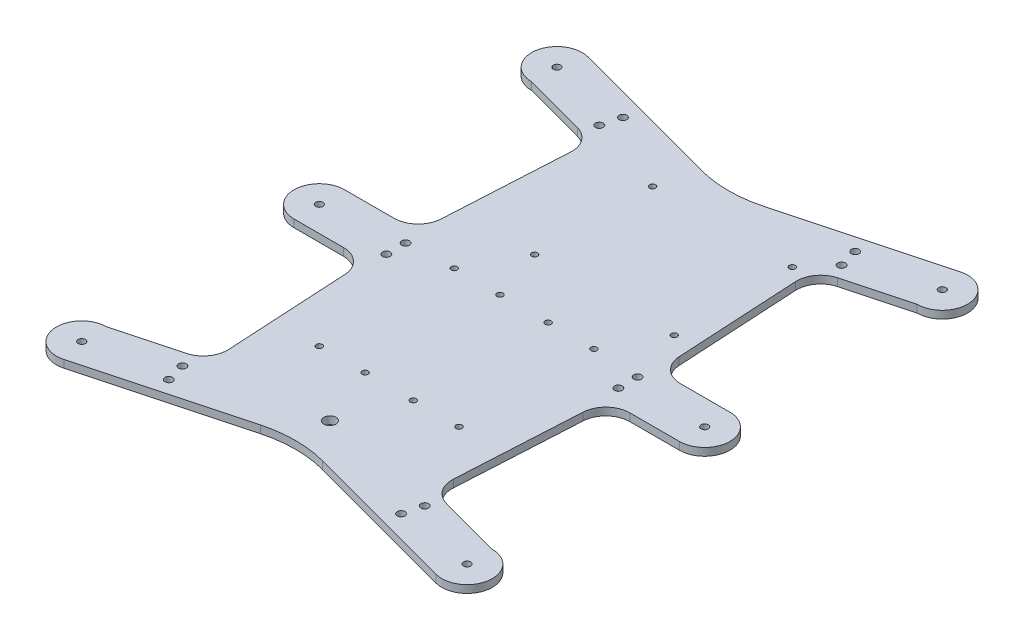
from build123d import *

# Parameters (mm, degrees)
SKETCH1_R               = 1.5
SKETCH1_R_2             = 1.6
BOSS_EXTRUDE1_DEPTH     = 3.175
FILLET1_R               = 50
FILLET2_R               = 10
CUT_EXTRUDE1_DEPTH      = 142.82756039
CUT_EXTRUDE1_DEPTH_BACK = 142.82756039
SKETCH2_R               = 1.25
SKETCH2_R_2             = 2.5


with BuildPart() as part:
    # Sketch1 → Boss-Extrude1 (new body)
    with BuildSketch(Plane(origin=(0, 0, 0), x_dir=(1, 0, 0), z_dir=(0, 1, 0))):
        with BuildLine():
            Line((-80, 10.5), (-50, 10.5))
            Line((-50, 10.5), (-46.19259608, 79.095931406))
            Line((-46.19259608, 79.095931406), (-80, 88.154597985))
            ThreePointArc((-80, 88.154597985), (-90.410171044, 100.025123003), (-77.282400026, 108.796819161))
            Line((-77.282400026, 108.796819161), (0, 88.089062485))
            Line((0, 88.089062485), (77.282400026, 108.796819161))
            ThreePointArc((77.282400026, 108.796819161), (90.410171044, 100.025123003), (80, 88.154597985))
            Line((80, 88.154597985), (46.19259608, 79.095931406))
            Line((46.19259608, 79.095931406), (50, 10.5))
            Line((50, 10.5), (80, 10.5))
            ThreePointArc((80, 10.5), (90.5, 0), (80, -10.5))
            Line((80, -10.5), (50, -10.5))
            Line((50, -10.5), (46.19259608, -79.095931406))
            Line((46.19259608, -79.095931406), (80, -88.154597985))
            ThreePointArc((80, -88.154597985), (90.410171044, -100.025123003), (77.282400026, -108.796819161))
            Line((77.282400026, -108.796819161), (0, -88.089062485))
            Line((0, -88.089062485), (-77.282400026, -108.796819161))
            ThreePointArc((-77.282400026, -108.796819161), (-90.410171044, -100.025123003), (-80, -88.154597985))
            Line((-80, -88.154597985), (-46.19259608, -79.095931406))
            Line((-46.19259608, -79.095931406), (-50, -10.5))
            Line((-50, -10.5), (-80, -10.5))
            ThreePointArc((-80, -10.5), (-90.5, 0), (-80, 10.5))
        make_face()
        with Locations((-80, 98.654597985)):
            Circle(SKETCH1_R, mode=Mode.SUBTRACT)
        with Locations((-80, 0)):
            Circle(SKETCH1_R, mode=Mode.SUBTRACT)
        with Locations((80, 0)):
            Circle(SKETCH1_R, mode=Mode.SUBTRACT)
        with Locations((80, 98.654597985)):
            Circle(SKETCH1_R, mode=Mode.SUBTRACT)
        with Locations((80, -98.654597985)):
            Circle(SKETCH1_R, mode=Mode.SUBTRACT)
        with Locations((-80, -98.654597985)):
            Circle(SKETCH1_R, mode=Mode.SUBTRACT)
        with Locations((-48.175, 4)):
            Circle(SKETCH1_R_2, mode=Mode.SUBTRACT)
        with Locations((-50.294686759, 86.553978569)):
            Circle(SKETCH1_R_2, mode=Mode.SUBTRACT)
        with Locations((-48.224134398, 94.28138518)):
            Circle(SKETCH1_R_2, mode=Mode.SUBTRACT)
        with Locations((-50.294686759, -86.553978569)):
            Circle(SKETCH1_R_2, mode=Mode.SUBTRACT)
        with Locations((-48.224134398, -94.28138518)):
            Circle(SKETCH1_R_2, mode=Mode.SUBTRACT)
        with Locations((-48.175, -4)):
            Circle(SKETCH1_R_2, mode=Mode.SUBTRACT)
        with Locations((48.224134398, -94.28138518)):
            Circle(SKETCH1_R_2, mode=Mode.SUBTRACT)
        with Locations((50.294686759, -86.553978569)):
            Circle(SKETCH1_R_2, mode=Mode.SUBTRACT)
        with Locations((48.175, -4)):
            Circle(SKETCH1_R_2, mode=Mode.SUBTRACT)
        with Locations((48.175, 4)):
            Circle(SKETCH1_R_2, mode=Mode.SUBTRACT)
        with Locations((48.224134398, 94.28138518)):
            Circle(SKETCH1_R_2, mode=Mode.SUBTRACT)
        with Locations((50.294686759, 86.553978569)):
            Circle(SKETCH1_R_2, mode=Mode.SUBTRACT)
    extrude(amount=BOSS_EXTRUDE1_DEPTH)

    # Fillet1
    fillet1_edges = [part.edges().sort_by_distance(p)[0] for p in [
        (0, 1.5875, -88.089062485),
        (0, 1.5875, 88.089062485),
    ]]
    fillet(fillet1_edges, radius=FILLET1_R)

    # Fillet2
    fillet2_edges = [part.edges().sort_by_distance(p)[0] for p in [
        (46.19259608, 1.5875, 79.095931406),
        (50, 1.5875, 10.5),
        (50, 1.5875, -10.5),
        (46.19259608, 1.5875, -79.095931406),
        (-46.19259608, 1.5875, -79.095931406),
        (-50, 1.5875, -10.5),
        (-50, 1.5875, 10.5),
        (-46.19259608, 1.5875, 79.095931406),
    ]]
    fillet(fillet2_edges, radius=FILLET2_R)

    # Sketch2 → Cut-Extrude1 (cut, two sides: drawn at the far end of the back side and taken through both)
    with BuildSketch(Plane(origin=(0, 3.175, 0), x_dir=(1, 0, 0), z_dir=(0, 1, 0)).offset(-CUT_EXTRUDE1_DEPTH_BACK)):
        with Locations((-17.25, 75.618974869)):
            Circle(SKETCH2_R)
        with Locations((40.75, 75.618974869)):
            Circle(SKETCH2_R)
        with Locations((40.75, 26.618974869)):
            Circle(SKETCH2_R)
        with Locations((-17.25, 26.618974869)):
            Circle(SKETCH2_R)
        with Locations((0, -75.602871505)):
            Circle(SKETCH2_R_2)
        with Locations((-10, 5)):
            Circle(SKETCH2_R)
        with Locations((-10, -51)):
            Circle(SKETCH2_R)
        with Locations((-29, 5)):
            Circle(SKETCH2_R)
        with Locations((-29, -51)):
            Circle(SKETCH2_R)
        with Locations((29, -51)):
            Circle(SKETCH2_R)
        with Locations((29, 5)):
            Circle(SKETCH2_R)
        with Locations((10, -51)):
            Circle(SKETCH2_R)
        with Locations((10, 5)):
            Circle(SKETCH2_R)
    extrude(amount=CUT_EXTRUDE1_DEPTH + CUT_EXTRUDE1_DEPTH_BACK, mode=Mode.SUBTRACT)


solid = part.part
